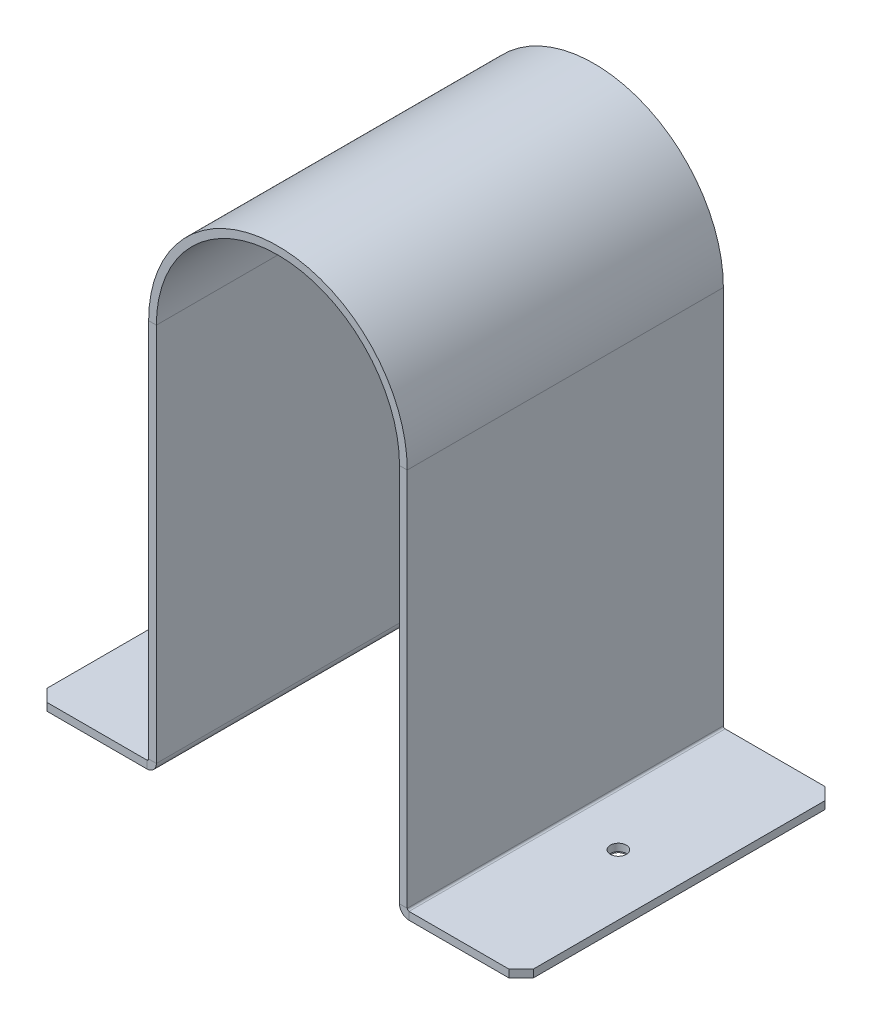
from build123d import *

# Parameters (mm, degrees)
BASE_FLANGE1_DEPTH             = 65
CHAMFER1_SIZE                  = 5
F_6_6_6_6_DIAMETER_HOLE1_D     = 6.6
F_6_6_6_6_DIAMETER_HOLE1_DEPTH = 3
F_6_6_6_6_DIAMETER_HOLE1_TIP   = 1.982840043


# Sheet-metal steps are written as plain solids
with BuildPart() as part:
    # Sketch1 → Base-Flange1 (new, symmetric)
    with BuildSketch(Plane.XY):
        with BuildLine():
            Line((-100, 0), (-53.9116, 0))
            ThreePointArc((-53.9116, 0), (-51.145681115, 1.145681115), (-50, 3.9116))
            Line((-50, 3.9116), (-50, 160))
            ThreePointArc((-50, 160), (0, 210), (50, 160))
            Line((50, 160), (50, 3.9116))
            ThreePointArc((50, 3.9116), (51.145681115, 1.145681115), (53.9116, 0))
            Line((53.9116, 0), (100, 0))
            Line((100, 0), (100, 3.175))
            Line((100, 3.175), (53.9116, 3.175))
            ThreePointArc((53.9116, 3.175), (53.390745145, 3.390745145), (53.175, 3.9116))
            Line((53.175, 3.9116), (53.175, 160))
            ThreePointArc((53.175, 160), (0, 213.175), (-53.175, 160))
            Line((-53.175, 160), (-53.175, 3.9116))
            ThreePointArc((-53.175, 3.9116), (-53.390745145, 3.390745145), (-53.9116, 3.175))
            Line((-53.9116, 3.175), (-100, 3.175))
            Line((-100, 3.175), (-100, 0))
        make_face()
    extrude(amount=BASE_FLANGE1_DEPTH, both=True)

    # Chamfer1
    chamfer1_edges = [part.edges().sort_by_distance(p)[0] for p in [
        (-100, 1.5875, -65),
        (100, 1.5875, -65),
        (-100, 1.5875, 65),
        (100, 1.5875, 65),
    ]]
    chamfer(chamfer1_edges, length=CHAMFER1_SIZE)

    # Ø6.6 (6.6) Diameter Hole1
    with Locations(Plane(origin=(75, 3.175, 0), x_dir=(0, 0, 1), z_dir=(0, 1, 0))):
        with Locations((0, 0), (0, -150)):
            Hole(F_6_6_6_6_DIAMETER_HOLE1_D / 2, depth=F_6_6_6_6_DIAMETER_HOLE1_DEPTH)
            with Locations((0, 0, -(F_6_6_6_6_DIAMETER_HOLE1_DEPTH + F_6_6_6_6_DIAMETER_HOLE1_TIP / 2))):  # 118° drill point
                Cone(0, F_6_6_6_6_DIAMETER_HOLE1_D / 2, F_6_6_6_6_DIAMETER_HOLE1_TIP, mode=Mode.SUBTRACT)


solid = part.part
